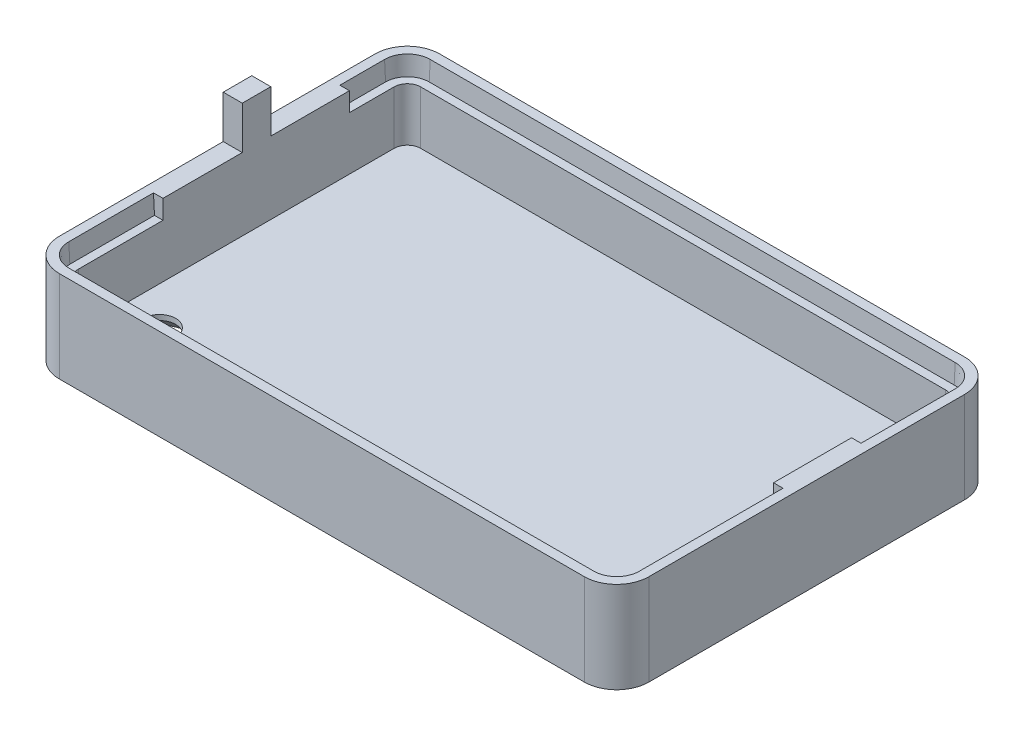
from build123d import *

# Parameters (mm, degrees)
SKETCH1_R                                       = 1.7
BOSS_EXTRUDE1_DEPTH                             = 2
BOSS_EXTRUDE2_DEPTH                             = 7.6
SKETCH3_W                                       = 2
SKETCH3_H                                       = 3
BOSS_EXTRUDE3_DEPTH                             = 4.5
CSK_FOR_M3_FLAT_HEAD_MACHINE_SCREW1_D           = 3.4
CSK_FOR_M3_FLAT_HEAD_MACHINE_SCREW1_CSINK_D     = 6.3
CSK_FOR_M3_FLAT_HEAD_MACHINE_SCREW1_CSINK_ANGLE = 90
SKETCH6_W                                       = 2
SKETCH6_H                                       = 8.265
SKETCH6_H_2                                     = 8.335
SKETCH6_H_3                                     = 3.6
CUT_EXTRUDE1_DEPTH                              = 1
GROOVE2_START                                   = -18
GROOVE2_OUTLINE_W                               = 58
GROOVE2_OUTLINE_H                               = 2
GROOVE2_DEPTH                                   = 36.20069
GROOVE2_START_2                                 = 7.697541275
GROOVE2_2_DEPTH                                 = 8.902458725
GROOVE2_START_3                                 = -16.6
GROOVE2_3_DEPTH                                 = 9.9
GROOVE2_START_4                                 = 1.5
GROOVE2_4_DEPTH                                 = 6.197541275
GROOVE2_5_DEPTH                                 = 4.697541275
BOSS_EXTRUDE4_DEPTH                             = 1


with BuildPart() as part:
    # Sketch1 → Boss-Extrude1 (new body)
    with BuildSketch(Plane(origin=(0, 0, 0), x_dir=(1, 0, 0), z_dir=(0, 1, 0))):
        with BuildLine():
            Line((-27.6, 20), (27.6, 20))
            ThreePointArc((27.6, 20), (30.004163056, 19.004163056), (31, 16.6))
            Line((31, 16.6), (31, -16.6))
            ThreePointArc((31, -16.6), (30.004163056, -19.004163056), (27.6, -20))
            Line((27.6, -20), (-27.6, -20))
            ThreePointArc((-27.6, -20), (-30.004163056, -19.004163056), (-31, -16.6))
            Line((-31, -16.6), (-31, 16.6))
            ThreePointArc((-31, 16.6), (-30.004163056, 19.004163056), (-27.6, 20))
        make_face()
        with Locations(Location((-25, -12.06, 0), (0, 0, 270))):
            Circle(SKETCH1_R, mode=Mode.SUBTRACT)
        with Locations(Location((25, -12.06, 0), (0, 0, 270))):
            Circle(SKETCH1_R, mode=Mode.SUBTRACT)
        with Locations(Location((25, 12.94, 0), (0, 0, 270))):
            Circle(SKETCH1_R, mode=Mode.SUBTRACT)
    extrude(amount=BOSS_EXTRUDE1_DEPTH)

    # Sketch2 → Boss-Extrude2 (add)
    with BuildSketch(Plane(origin=(0, 2, 0), x_dir=(1, 0, 0), z_dir=(0, 1, 0))):
        with BuildLine():
            Line((-27.6, -20), (27.6, -20))
            ThreePointArc((27.6, -20), (30.004163056, -19.004163056), (31, -16.6))
            Line((31, -16.6), (31, 16.6))
            ThreePointArc((31, 16.6), (30.004163056, 19.004163056), (27.6, 20))
            Line((27.6, 20), (-27.6, 20))
            ThreePointArc((-27.6, 20), (-30.004163056, 19.004163056), (-31, 16.6))
            Line((-31, 16.6), (-31, -16.6))
            ThreePointArc((-31, -16.6), (-30.004163056, -19.004163056), (-27.6, -20))
        make_face()
        with BuildLine():
            Line((27.6, 18), (-27.6, 18))
            ThreePointArc((-27.6, 18), (-28.589949494, 17.589949494), (-29, 16.6))
            Line((-29, 16.6), (-29, -16.6))
            ThreePointArc((-29, -16.6), (-28.589949494, -17.589949494), (-27.6, -18))
            Line((-27.6, -18), (27.6, -18))
            ThreePointArc((27.6, -18), (28.589949494, -17.589949494), (29, -16.6))
            Line((29, -16.6), (29, 16.6))
            ThreePointArc((29, 16.6), (28.589949494, 17.589949494), (27.6, 18))
        make_face(mode=Mode.SUBTRACT)
    extrude(amount=BOSS_EXTRUDE2_DEPTH)

    # Sketch3 → Boss-Extrude3 (add)
    with BuildSketch(Plane(origin=(0, 9.6, 0), x_dir=(1, 0, 0), z_dir=(0, 1, 0))):
        with Locations((-30, 2.137458725)):
            Rectangle(SKETCH3_W, SKETCH3_H)
    extrude(amount=BOSS_EXTRUDE3_DEPTH)

    # CSK for M3 Flat Head Machine Screw1 (through all)
    with Locations(Plane(origin=(-25, 0, 12.06), x_dir=(0, 0, -1), z_dir=(0, -1, 0))):
        with Locations((0, 0), (0, 50), (25, 50)):
            CounterSinkHole(CSK_FOR_M3_FLAT_HEAD_MACHINE_SCREW1_D / 2, CSK_FOR_M3_FLAT_HEAD_MACHINE_SCREW1_CSINK_D / 2, counter_sink_angle=CSK_FOR_M3_FLAT_HEAD_MACHINE_SCREW1_CSINK_ANGLE)

    # Sketch6 → Cut-Extrude1 (cut)
    with BuildSketch(Plane(origin=(0, 9.6, 0), x_dir=(1, 0, 0), z_dir=(0, 1, 0))):
        with Locations((-30, 7.769958725)):
            Rectangle(SKETCH6_W, SKETCH6_H)
        with Locations((-30, -3.530041275)):
            Rectangle(SKETCH6_W, SKETCH6_H_2)
        with Locations((30, 4.9)):
            Rectangle(SKETCH6_W, SKETCH6_H_3)
        with Locations((30, 0.3)):
            Rectangle(SKETCH6_W, SKETCH6_H_3)
    extrude(amount=-CUT_EXTRUDE1_DEPTH, mode=Mode.SUBTRACT)

    # Groove2: read off the stored shape, not the designer's step
    # Groove2 outline → Groove2 (cut)
    with BuildSketch(Plane.XY.offset(GROOVE2_START)):
        with Locations((0, 8.6)):
            Rectangle(GROOVE2_OUTLINE_W, GROOVE2_OUTLINE_H)
    extrude(amount=GROOVE2_DEPTH, mode=Mode.SUBTRACT)

    # Groove2 2 outline → Groove2 2 (cut)
    with BuildSketch(Plane.XY.offset(GROOVE2_START_2)):
        Polygon((29, 7.6), (29.895184441, 7.6), (30, 9.6), (29, 9.6), align=None)
        Polygon((-29.895184441, 7.6), (-29, 7.6), (-29, 9.6), (-30, 9.6), align=None)
    extrude(amount=GROOVE2_2_DEPTH, mode=Mode.SUBTRACT)

    # Groove2 3 outline → Groove2 3 (cut)
    with BuildSketch(Plane.XY.offset(GROOVE2_START_3)):
        Polygon((29, 7.6), (29.895184441, 7.6), (30, 9.6), (29, 9.6), align=None)
    extrude(amount=GROOVE2_3_DEPTH, mode=Mode.SUBTRACT)

    # Groove2 4 outline → Groove2 4 (cut)
    with BuildSketch(Plane.XY.offset(GROOVE2_START_4)):
        Polygon((29, 7.6), (29.895184441, 7.6), (30, 9.6), (29, 9.6), align=None)
    extrude(amount=GROOVE2_4_DEPTH, mode=Mode.SUBTRACT)

    # Groove2 5 outline → Groove2 5 (cut)
    with BuildSketch(Plane.XY.offset(GROOVE2_START_3)):
        Polygon((-29.895184441, 7.6), (-29, 7.6), (-29, 9.6), (-30, 9.6), align=None)
    extrude(amount=GROOVE2_5_DEPTH, mode=Mode.SUBTRACT)

    # Groove2 6: loft between two sections, ruled curve by curve
    groove2_6_from = [
        Edge.make_three_point_arc((-29.895184441, 7.6, 16.6), (-29.222940483, 7.6, 18.222940483), (-27.6, 7.6, 18.895184441)),
        Edge.make_three_point_arc((27.6, 7.6, 18.895184441), (29.222940483, 7.6, 18.222940483), (29.895184441, 7.6, 16.6)),
        Edge.make_line((27.6, 7.6, 18.895184441), (-27.6, 7.6, 18.895184441)),
        Edge.make_line((29.895184441, 7.6, 16.6), (-29.895184441, 7.6, 16.6)),
    ]
    groove2_6_to = [
        Edge.make_three_point_arc((-30, 9.6, 16.6), (-29.297056275, 9.6, 18.297056275), (-27.6, 9.6, 19)),
        Edge.make_three_point_arc((27.6, 9.6, 19), (29.297056275, 9.6, 18.297056275), (30, 9.6, 16.6)),
        Edge.make_line((27.6, 9.6, 19), (-27.6, 9.6, 19)),
        Edge.make_line((30, 9.6, 16.6), (-30, 9.6, 16.6)),
    ]
    groove2_6 = Solid(Shell([*[Face.make_surface_from_curves(groove2_6_from[k], groove2_6_to[k]) for k in range(4)], Face(Wire(groove2_6_from)), Face(Wire(groove2_6_to))]))
    add(groove2_6, mode=Mode.SUBTRACT)

    # Groove2 7: loft between two sections, ruled curve by curve
    groove2_7_from = [
        Edge.make_three_point_arc((29.895184441, 7.6, -16.6), (29.222940483, 7.6, -18.222940483), (27.6, 7.6, -18.895184441)),
        Edge.make_three_point_arc((-27.6, 7.6, -18.895184441), (-29.222940483, 7.6, -18.222940483), (-29.895184441, 7.6, -16.6)),
        Edge.make_line((-27.6, 7.6, -18.895184441), (27.6, 7.6, -18.895184441)),
        Edge.make_line((-29.895184441, 7.6, -16.6), (29.895184441, 7.6, -16.6)),
    ]
    groove2_7_to = [
        Edge.make_three_point_arc((30, 9.6, -16.6), (29.297056275, 9.6, -18.297056275), (27.6, 9.6, -19)),
        Edge.make_three_point_arc((-27.6, 9.6, -19), (-29.297056275, 9.6, -18.297056275), (-30, 9.6, -16.6)),
        Edge.make_line((-27.6, 9.6, -19), (27.6, 9.6, -19)),
        Edge.make_line((-30, 9.6, -16.6), (30, 9.6, -16.6)),
    ]
    groove2_7 = Solid(Shell([*[Face.make_surface_from_curves(groove2_7_from[k], groove2_7_to[k]) for k in range(4)], Face(Wire(groove2_7_from)), Face(Wire(groove2_7_to))]))
    add(groove2_7, mode=Mode.SUBTRACT)

    # Sketch7 → Boss-Extrude4 (add)
    with BuildSketch(Plane(origin=(0, 8.6, 0), x_dir=(1, 0, 0), z_dir=(0, 1, 0))):
        Polygon((-31, 11.902458725), (-31, 3.637458725), (-29, 3.637458725), (-29, 11.902458725), (-29.947592221, 11.902458725), align=None)
        Polygon((-29, -7.697541275), (-29, 0.637458725), (-31, 0.637458725), (-31, -7.697541275), (-29.947592221, -7.697541275), align=None)
        Polygon((29, 3.1), (31, 3.1), (31, 6.7), (29.947592221, 6.7), (29, 6.7), align=None)
        Polygon((31, 2.1), (29, 2.1), (29, -1.5), (29.947592221, -1.5), (31, -1.5), align=None)
    extrude(amount=BOSS_EXTRUDE4_DEPTH)


solid = part.part
